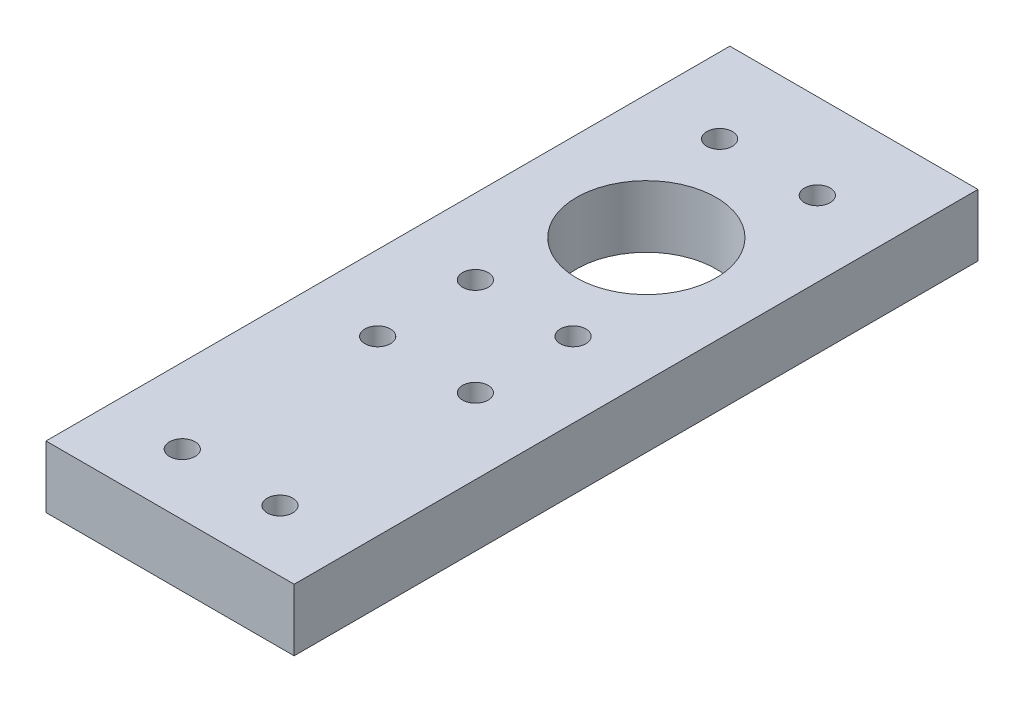
from build123d import *

# Parameters (mm, degrees)
SKETCH2_W           = 101.6
SKETCH2_H           = 280
BOSS_EXTRUDE1_DEPTH = 25.4
SKETCH3_R           = 5.25
SKETCH3_R_2         = 28.575
CUT_EXTRUDE1_DEPTH  = 25.4
SKETCH4_R           = 5.25
CUT_EXTRUDE2_DEPTH  = 25.4


with BuildPart() as part:
    # Sketch2 → Boss-Extrude1 (new body)
    with BuildSketch(Plane(origin=(0, 0, 0), x_dir=(1, 0, 0), z_dir=(0, 1, 0))):
        with Locations((50.8, 140)):
            Rectangle(SKETCH2_W, SKETCH2_H)
    extrude(amount=BOSS_EXTRUDE1_DEPTH)

    # Sketch3 → Cut-Extrude1 (cut)
    with BuildSketch(Plane(origin=(0, 25.4, 0), x_dir=(1, 0, 0), z_dir=(0, 1, 0))):
        with Locations((70.8, 245)):
            Circle(SKETCH3_R)
        with Locations((30.8, 245)):
            Circle(SKETCH3_R)
        with Locations((70.8, 145)):
            Circle(SKETCH3_R)
        with Locations((30.8, 145)):
            Circle(SKETCH3_R)
        with Locations((50.8, 195)):
            Circle(SKETCH3_R_2)
    extrude(amount=-CUT_EXTRUDE1_DEPTH, mode=Mode.SUBTRACT)

    # Sketch4 → Cut-Extrude2 (cut)
    with BuildSketch(Plane(origin=(0, 25.4, 0), x_dir=(1, 0, 0), z_dir=(0, 1, 0))):
        with Locations((70.8, 105)):
            Circle(SKETCH4_R)
        with Locations((30.8, 105)):
            Circle(SKETCH4_R)
        with Locations((30.8, 25)):
            Circle(SKETCH4_R)
        with Locations((70.8, 25)):
            Circle(SKETCH4_R)
    extrude(amount=-CUT_EXTRUDE2_DEPTH, mode=Mode.SUBTRACT)


solid = part.part
